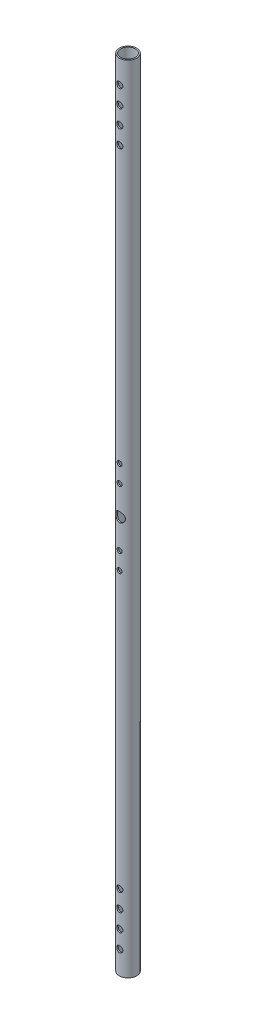
from build123d import *

# Parameters (mm, degrees)
SKETCH_1_R          = 7.5
SKETCH_1_R_2        = 6.375
EXTRUDE_1_DEPTH     = 685
SKETCH_2_R          = 2.65
SKETCH_2_R_2        = 2.15
SKETCH_2_R_3        = 4.15
CUT_EXTRUDE_1_DEPTH = 686.332948281


with BuildPart() as part:
    # 草图1 → 凸台-拉伸1 (new body)
    with BuildSketch(Plane(origin=(0, 0, 0), x_dir=(1, 0, 0), z_dir=(0, 1, 0))):
        Circle(SKETCH_1_R)
        Circle(SKETCH_1_R_2, mode=Mode.SUBTRACT)
    extrude(amount=EXTRUDE_1_DEPTH)

    # 草图2 → 切除-拉伸1 (cut, symmetric)
    with BuildSketch(Plane(origin=(12.5, 0, 0), x_dir=(1, 0, 0), z_dir=(0, 0, 1))):
        with Locations((-12.5, 20)):
            Circle(SKETCH_2_R)
        with Locations((-12.5, 35)):
            Circle(SKETCH_2_R)
        with Locations((-12.5, 50)):
            Circle(SKETCH_2_R)
        with Locations((-12.5, 65)):
            Circle(SKETCH_2_R)
        with Locations((-12.5, 302.5)):
            Circle(SKETCH_2_R_2)
        with Locations((-12.5, 317.5)):
            Circle(SKETCH_2_R_2)
        with Locations((-12.5, 342.5)):
            Circle(SKETCH_2_R_3)
        with Locations((-12.5, 367.5)):
            Circle(SKETCH_2_R_2)
        with Locations((-12.5, 382.5)):
            Circle(SKETCH_2_R_2)
    cut_extrude_1 = extrude(amount=CUT_EXTRUDE_1_DEPTH, both=True, mode=Mode.SUBTRACT)

    # 镜向1: 切除-拉伸1 across plane
    add(cut_extrude_1.mirror(Plane.ZX.offset(342.5)), mode=Mode.SUBTRACT)


solid = part.part
